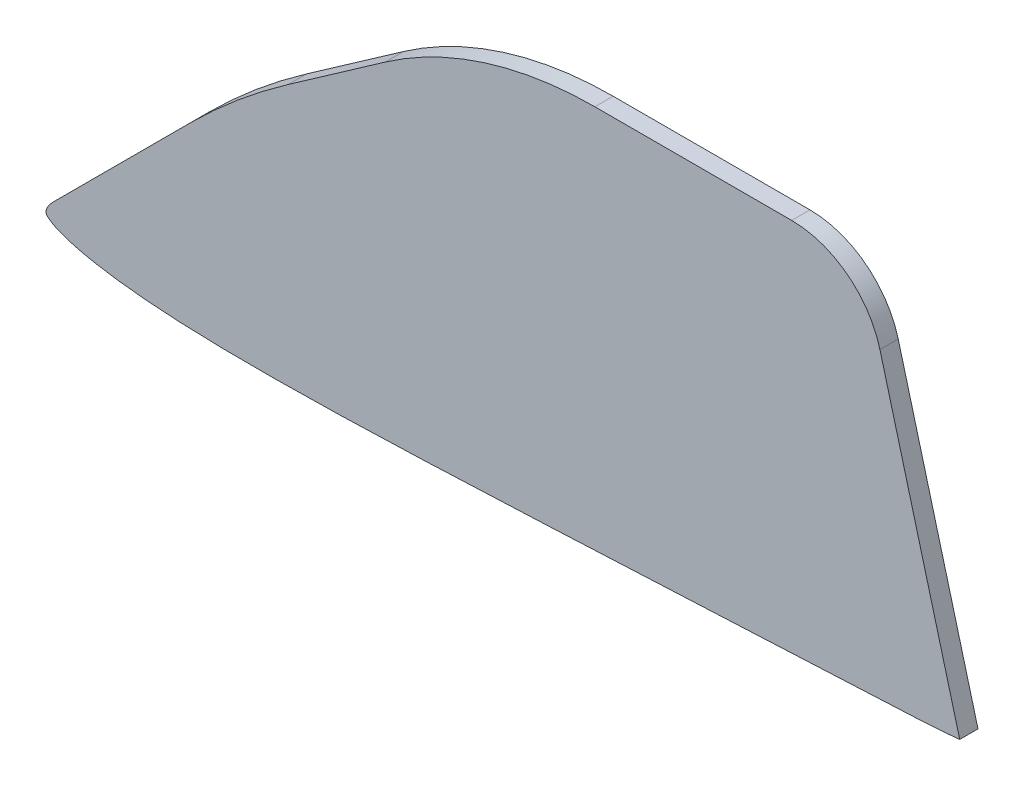
from build123d import *

# Parameters (mm, degrees)
BOSS_EXTRUDE1_DEPTH = 2
FILLET2_R           = 10
FILLET3_R           = 40
FILLET4_R           = 80


with BuildPart() as part:
    # Sketch1 → Boss-Extrude1 (new body)
    with BuildSketch(Plane.XY):
        with BuildLine():
            Line((240.765620284, 21.3113957), (220.765620284, 1.3113957))
            add(Edge.make_bspline(
                [(220.765620284, 1.3113957), (220.72663316, 1.272408575), (220.493626624, 1.032206135), (220.23379921, 0.706351654), (220.061642382, 0.318391358), (220.011602189, 0.139502643), (219.995925197, -0.002861211), (220.008120727, -0.115534154), (220.062041002, -0.21843611), (220.160266844, -0.337962224), (220.314496952, -0.477861912), (220.482600839, -0.598911233), (220.942116034, -0.893723302), (221.892375739, -1.29761444), (223.520457756, -1.784013523), (225.623980896, -2.227885385), (228.177131144, -2.613315253), (231.164121123, -2.919183773), (234.563486569, -3.13704422), (238.352012883, -3.267079886), (242.499561211, -3.312040739), (246.9689457, -3.284920505), (251.715996006, -3.193186176), (256.691386013, -3.047617228), (261.841513678, -2.857541871), (267.108766757, -2.638288597), (272.431487903, -2.398822278), (277.745717707, -2.151491009), (282.986461691, -1.901966392), (288.089354259, -1.658423301), (292.991669653, -1.423290263), (297.633381787, -1.201968071), (301.957838568, -0.995171113), (305.91027468, -0.808454245), (309.445141673, -0.639954363), (312.505114519, -0.492661458), (315.08917453, -0.359561985), (317.064072102, -0.250243866), (318.667228537, -0.135455891), (319.33987673, -0.063054382), (319.997867718, -0.003800804), (320, 0)],
                knots=[0.495962564, 0.495962564, 0.495962564, 0.495962564, 0.496775026, 0.500888993, 0.502031934, 0.503032492, 0.503621391, 0.504143577, 0.504679782, 0.505310677, 0.506426476, 0.507746346, 0.508370255, 0.514496902, 0.522891546, 0.533497445, 0.54624431, 0.561059304, 0.577878564, 0.59660209, 0.617103044, 0.639204159, 0.662685634, 0.687304872, 0.712801248, 0.738887215, 0.765254171, 0.791582967, 0.817548904, 0.842831994, 0.867120728, 0.890117968, 0.911543748, 0.931132077, 0.948635559, 0.963834135, 0.976537414, 0.986586626, 0.993888175, 0.998423524, 1, 1, 1, 1], degree=3))
            Line((320, 0), (309.282032303, 40))
            Line((309.282032303, 40), (267.455713264, 40))
            Line((267.455713264, 40), (240.765620284, 21.3113957))
        make_face()
    extrude(amount=BOSS_EXTRUDE1_DEPTH)

    # Fillet2
    fillet2_edges = [part.edges().sort_by_distance(p)[0] for p in [
        (309.282032303, 40, 1),
    ]]
    fillet(fillet2_edges, radius=FILLET2_R)

    # Fillet3
    fillet3_edges = [part.edges().sort_by_distance(p)[0] for p in [
        (267.455713264, 40, 1),
    ]]
    fillet(fillet3_edges, radius=FILLET3_R)

    # Fillet4
    fillet4_edges = [part.edges().sort_by_distance(p)[0] for p in [
        (240.765620284, 21.3113957, 1),
    ]]
    fillet(fillet4_edges, radius=FILLET4_R)


solid = part.part
